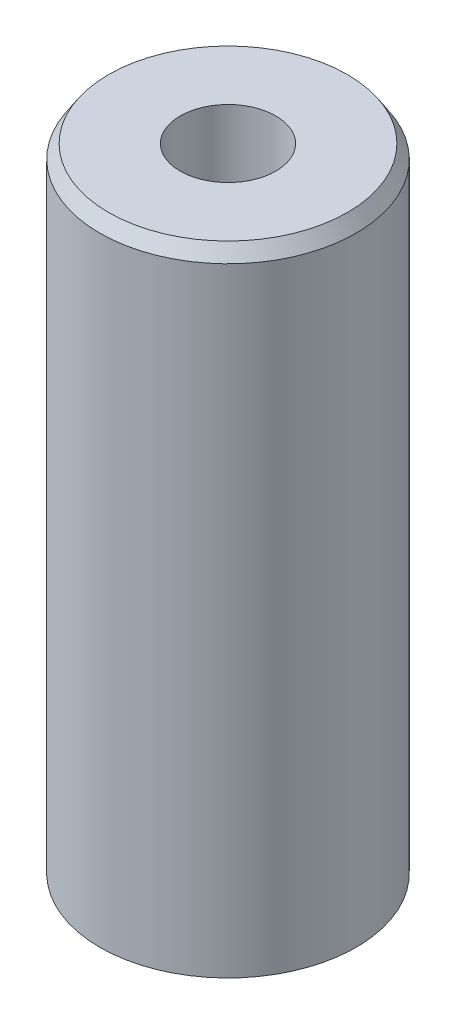
from build123d import *
from OCP.BRepFilletAPI import BRepFilletAPI_MakeChamfer

# Parameters (mm, degrees)
SKETCH1_R           = 10
BOSS_EXTRUDE1_DEPTH = 49.98198078
SKETCH2_R           = 3.730979911
CUT_EXTRUDE1_DEPTH  = 52.944185456
CHAMFER1_SIZE       = 1.054898941
CHAMFER1_SIZE2      = 0.682756355


with BuildPart() as part:
    # Sketch1 → Boss-Extrude1 (new body)
    with BuildSketch(Plane(origin=(0, 0, 0), x_dir=(1, 0, 0), z_dir=(0, 1, 0))):
        Circle(SKETCH1_R)
    extrude(amount=BOSS_EXTRUDE1_DEPTH)

    # Sketch2 → Cut-Extrude1 (cut, through all)
    with BuildSketch(Plane(origin=(0, 0, 0), x_dir=(1, 0, 0), z_dir=(0, 1, 0))):
        Circle(SKETCH2_R)
    extrude(amount=CUT_EXTRUDE1_DEPTH, mode=Mode.SUBTRACT)

    # Chamfer1: one chamfer whose edges measure the first distance from different faces: ONE call of the kernel's chamfer builder (chamfer() names one face for all edges)
    chamfer1_edges_1 = [part.edges().sort_by_distance(p)[0] for p in [
        (-10, 49.98198078, 0),
    ]]
    chamfer1_side_1 = [part.faces().sort_by_distance(p)[0] for p in [
        (-10, 24.99099039, 0),
    ]]
    chamfer1_edges_2 = [part.edges().sort_by_distance(p)[0] for p in [
        (-10, 0, 0),
    ]]
    chamfer1_side_2 = [part.faces().sort_by_distance(p)[0] for p in [
        (-9.717157288, 0, 0),
    ]]
    chamfer1 = BRepFilletAPI_MakeChamfer(part.part.solid().wrapped)
    for e in chamfer1_edges_1:
        chamfer1.Add(CHAMFER1_SIZE, CHAMFER1_SIZE2, e.wrapped, chamfer1_side_1[0].wrapped)  # the first distance lies on this face
    for e in chamfer1_edges_2:
        chamfer1.Add(CHAMFER1_SIZE, CHAMFER1_SIZE2, e.wrapped, chamfer1_side_2[0].wrapped)  # the first distance lies on this face
    add(Compound.cast(chamfer1.Shape()), mode=Mode.REPLACE)


solid = part.part
